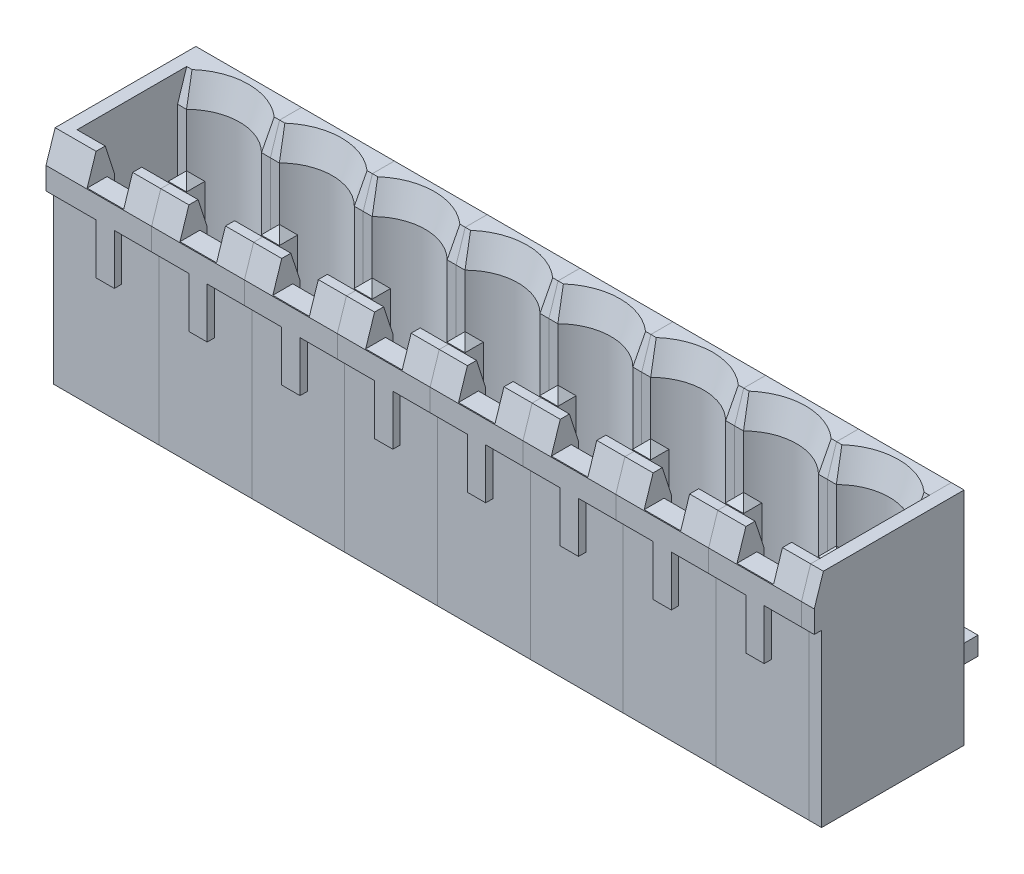
from build123d import *
from OCP.BRepFilletAPI import BRepFilletAPI_MakeChamfer

# Parameters (mm, degrees)
SKETCH_1_W             = 5.08
SKETCH_1_H             = 12.1
EXTRUDE_1_DEPTH        = 8.2
CUT_EXTRUDE_1_DEPTH    = 8.7
SKETCH_3_R             = 1.2
EXTRUDE_2_DEPTH        = 2
FILLET_1_R             = 0.25
CHAMFER_1_SIZE         = 0.5
CHAMFER_1_SIZE2        = 1.538841769
SKETCH_4_W             = 2
SKETCH_4_H             = 1.010953213
CUT_EXTRUDE_2_DEPTH    = 4.75
SKETCH_5_W             = 2
SKETCH_5_H             = 1.705458635
CUT_EXTRUDE_3_DEPTH    = 1.5
CHAMFER_2_SIZE         = 0.5
CHAMFER_2_SIZE2        = 1.538841769
SKETCH_6_W             = 5.08
SKETCH_6_H             = 6.6
CUT_EXTRUDE_4_DEPTH    = 0.4
SKETCH_7_W             = 2.04
SKETCH_7_H             = 2.75
CUT_EXTRUDE_5_DEPTH    = 0.4
EXTRUDE_1_2_DEPTH      = 0.5
EXTRUDE_1_2_DEPTH_BACK = 0.5
CHAMFER_3_SIZE         = 0.5
SKETCH_9_W             = 1
SKETCH_9_H             = 2.1
SKETCH_9_W_2           = 1.04
CUT_EXTRUDE_6_DEPTH    = 6
PATTERN_LINEAR_1_COUNT = 8
PATTERN_LINEAR_1_PITCH = 5.08
EXTRUDE_3_DEPTH        = 0.7
EXTRUDE_4_DEPTH        = 0.7
MOVE_BODY_1_ANGLE      = 180


with BuildPart() as part:
    # Эскиз1 → Extrude 1 (new body)
    with BuildSketch(Plane(origin=(0, 0, 0), x_dir=(1, 0, 0), z_dir=(0, 1, 0))):
        Rectangle(SKETCH_1_W, SKETCH_1_H)
    extrude(amount=EXTRUDE_1_DEPTH)

    # Эскиз2 → Вырез-Вытянуть1 (cut)
    with BuildSketch(Plane.XY.offset(6.05)):
        with BuildLine():
            Line((-2.54, 6.7), (2.54, 6.7))
            Line((2.54, 6.7), (2.54, 1.7))
            Line((2.54, 1.7), (2.05121915, 1.7))
            ThreePointArc((2.05121915, 1.7), (0, 0.85), (-2.05121915, 1.7))
            Line((-2.05121915, 1.7), (-2.54, 1.7))
            Line((-2.54, 1.7), (-2.54, 6.7))
        make_face()
    extrude(amount=-CUT_EXTRUDE_1_DEPTH, mode=Mode.SUBTRACT)

    # Эскиз3 → Бобышка-Вытянуть2 (add)
    with BuildSketch(Plane.XY.offset(-2.65)):
        with Locations((0, 3.75)):
            Circle(SKETCH_3_R)
    extrude(amount=EXTRUDE_2_DEPTH)

    # Скругление1
    fillet_1_edges = [part.edges().sort_by_distance(p)[0] for p in [
        (-1.2, 3.75, -0.65),
    ]]
    fillet(fillet_1_edges, radius=FILLET_1_R)

    # Фаска1: one chamfer whose edges measure the first distance from different faces: ONE call of the kernel's chamfer builder (chamfer() names one face for all edges)
    chamfer_1_edges_1 = [part.edges().sort_by_distance(p)[0] for p in [
        (0, 6.7, 6.05),
    ]]
    chamfer_1_side_1 = [part.faces().sort_by_distance(p)[0] for p in [
        (0, 7.45, 6.05),
    ]]
    chamfer_1_edges_2 = [part.edges().sort_by_distance(p)[0] for p in [
        (2.295609575, 1.7, 6.05),
        (-2.295609575, 1.7, 6.05),
        (0, 0.85, 6.05),
    ]]
    chamfer_1_side_2 = [part.faces().sort_by_distance(p)[0] for p in [
        (0, 0.655214235, 6.05),
    ]]
    chamfer_1 = BRepFilletAPI_MakeChamfer(part.part.solid().wrapped)
    for e in chamfer_1_edges_1:
        chamfer_1.Add(CHAMFER_1_SIZE, CHAMFER_1_SIZE2, e.wrapped, chamfer_1_side_1[0].wrapped)  # the first distance lies on this face
    for e in chamfer_1_edges_2:
        chamfer_1.Add(CHAMFER_1_SIZE, CHAMFER_1_SIZE2, e.wrapped, chamfer_1_side_2[0].wrapped)  # the first distance lies on this face
    add(Compound.cast(chamfer_1.Shape()), mode=Mode.REPLACE)

    # Эскиз4 → Вырез-Вытянуть2 (cut)
    with BuildSketch(Plane.XY.offset(6.05)):
        with Locations((0, 6.594523394)):
            Rectangle(SKETCH_4_W, SKETCH_4_H)
    extrude(amount=-CUT_EXTRUDE_2_DEPTH, mode=Mode.SUBTRACT)

    # Эскиз5 → Вырез-Вытянуть3 (cut)
    with BuildSketch(Plane.XY.offset(6.05)):
        with Locations((0, 7.552729318)):
            Rectangle(SKETCH_5_W, SKETCH_5_H)
    extrude(amount=-CUT_EXTRUDE_3_DEPTH, mode=Mode.SUBTRACT)

    # Фаска2
    chamfer_2_edges = [part.edges().sort_by_distance(p)[0] for p in [
        (-1.77, 8.2, 6.05),
    ]]
    chamfer_2_side = [part.faces().sort_by_distance(p)[0] for p in [
        (-1.77, 7.7, 6.05),
    ]]
    chamfer(chamfer_2_edges, length=CHAMFER_2_SIZE, length2=CHAMFER_2_SIZE2, reference=chamfer_2_side[0])

    # Эскиз6 → Вырез-Вытянуть4 (cut)
    with BuildSketch(Plane(origin=(0, 8.2, 0), x_dir=(1, 0, 0), z_dir=(0, 1, 0))):
        with Locations((0, 2.75)):
            Rectangle(SKETCH_6_W, SKETCH_6_H)
    extrude(amount=-CUT_EXTRUDE_4_DEPTH, mode=Mode.SUBTRACT)

    # Эскиз7 → Вырез-Вытянуть5 (cut)
    with BuildSketch(Plane(origin=(0, 8.2, 0), x_dir=(1, 0, 0), z_dir=(0, 1, 0))):
        with Locations((1.52, -1.925)):
            Rectangle(SKETCH_7_W, SKETCH_7_H)
        with Locations((-1.52, -1.925)):
            Rectangle(SKETCH_7_W, SKETCH_7_H)
    extrude(amount=-CUT_EXTRUDE_5_DEPTH, mode=Mode.SUBTRACT)

    # Эскиз9 → Вырез-Вытянуть6 (cut)
    with BuildSketch(Plane.XZ):
        with Locations((0, -5)):
            Rectangle(SKETCH_9_W, SKETCH_9_H)
        with Locations((-2.02, -5)):
            Rectangle(SKETCH_9_W_2, SKETCH_9_H)
        with Locations((2.02, -5)):
            Rectangle(SKETCH_9_W_2, SKETCH_9_H)
    extrude(amount=-CUT_EXTRUDE_6_DEPTH, mode=Mode.SUBTRACT)


with BuildPart() as body_2:
    # Эскиз8 → Extrude 1 2 (new, two sides: drawn at the far end of the back side and taken through both)
    with BuildSketch(Plane(origin=(0, 0, 0), x_dir=(0, 0, -1), z_dir=(1, 0, 0)).offset(-EXTRUDE_1_2_DEPTH_BACK)):
        with BuildLine():
            Line((-3.65, 3.25), (3.95, 3.25))
            Line((3.95, 3.25), (3.95, -4))
            Line((3.95, -4), (4.95, -4))
            Line((4.95, -4), (4.95, 3.25))
            ThreePointArc((4.95, 3.25), (4.657106781, 3.957106781), (3.95, 4.25))
            Line((3.95, 4.25), (-3.65, 4.25))
            Line((-3.65, 4.25), (-3.65, 3.25))
        make_face()
    extrude(amount=EXTRUDE_1_2_DEPTH + EXTRUDE_1_2_DEPTH_BACK)

    # Фаска3
    chamfer_3_edges = [body_2.edges().sort_by_distance(p)[0] for p in [
        (0, 3.25, 3.65),
        (0, 4.25, 3.65),
        (0, -4, -4.95),
        (0, -4, -3.95),
        (0.5, -4, -4.45),
        (0.5, 3.75, 3.65),
        (-0.5, 3.75, 3.65),
        (-0.5, -4, -4.45),
    ]]
    chamfer(chamfer_3_edges, length=CHAMFER_3_SIZE - 0.0001)  # a hair under: the kernel refuses the full size


with BuildPart() as pattern_linear_1_1:
    # Линейный массив1: pattern copy
    add(body_2.part.moved(Location(Vector(-1, 0, 0) * (1 * PATTERN_LINEAR_1_PITCH))))


with BuildPart() as pattern_linear_1_2:
    # Линейный массив1: pattern copy
    add(body_2.part.moved(Location(Vector(-1, 0, 0) * (2 * PATTERN_LINEAR_1_PITCH))))


with BuildPart() as pattern_linear_1_3:
    # Линейный массив1: pattern copy
    add(body_2.part.moved(Location(Vector(-1, 0, 0) * (3 * PATTERN_LINEAR_1_PITCH))))


with BuildPart() as pattern_linear_1_4:
    # Линейный массив1: pattern copy
    add(body_2.part.moved(Location(Vector(-1, 0, 0) * (4 * PATTERN_LINEAR_1_PITCH))))


with BuildPart() as pattern_linear_1_5:
    # Линейный массив1: pattern copy
    add(body_2.part.moved(Location(Vector(-1, 0, 0) * (5 * PATTERN_LINEAR_1_PITCH))))


with BuildPart() as pattern_linear_1_6:
    # Линейный массив1: pattern copy
    add(body_2.part.moved(Location(Vector(-1, 0, 0) * (6 * PATTERN_LINEAR_1_PITCH))))


with BuildPart() as pattern_linear_1_7:
    # Линейный массив1: pattern copy
    add(body_2.part.moved(Location(Vector(-1, 0, 0) * (7 * PATTERN_LINEAR_1_PITCH))))


with BuildPart() as pattern_linear_1_8:
    # Линейный массив1: pattern copy
    add(part.part.moved(Location(Vector(-1, 0, 0) * (1 * PATTERN_LINEAR_1_PITCH))))


with BuildPart() as pattern_linear_1_9:
    # Линейный массив1: pattern copy
    add(part.part.moved(Location(Vector(-1, 0, 0) * (2 * PATTERN_LINEAR_1_PITCH))))


with BuildPart() as pattern_linear_1_10:
    # Линейный массив1: pattern copy
    add(part.part.moved(Location(Vector(-1, 0, 0) * (3 * PATTERN_LINEAR_1_PITCH))))


with BuildPart() as pattern_linear_1_11:
    # Линейный массив1: pattern copy
    add(part.part.moved(Location(Vector(-1, 0, 0) * (4 * PATTERN_LINEAR_1_PITCH))))


with BuildPart() as pattern_linear_1_12:
    # Линейный массив1: pattern copy
    add(part.part.moved(Location(Vector(-1, 0, 0) * (5 * PATTERN_LINEAR_1_PITCH))))


with BuildPart() as pattern_linear_1_13:
    # Линейный массив1: pattern copy
    add(part.part.moved(Location(Vector(-1, 0, 0) * (6 * PATTERN_LINEAR_1_PITCH))))


with BuildPart() as pattern_linear_1_14:
    # Линейный массив1: pattern copy
    add(part.part.moved(Location(Vector(-1, 0, 0) * (7 * PATTERN_LINEAR_1_PITCH))))


with BuildPart() as part_1:
    add(part.part)

    # Эскиз10 → Бобышка-Вытянуть3 (add)
    with BuildSketch(Plane(origin=(2.54, 0, 0), x_dir=(0, 0, -1), z_dir=(1, 0, 0))):
        Polygon((6.05, 7.8), (-3.3, 7.8), (-3.3, 8.2), (-4.511158231, 8.2), (-6.05, 7.7), (-6.05, 0), (6.05, 0), align=None)
    extrude(amount=EXTRUDE_3_DEPTH)


with BuildPart() as body_17:
    # Эскиз11 → Бобышка-Вытянуть4 (new body)
    with BuildSketch(Plane.ZY.offset(38.1)):
        Polygon((-6.05, 7.8), (-6.05, 0), (6.05, 0), (6.05, 7.7), (4.511158231, 8.2), (3.3, 8.2), (3.3, 7.8), align=None)
    extrude(amount=EXTRUDE_4_DEPTH)


with BuildPart() as body_2_1:
    # Move Body 1: moved
    add(body_2.part.rotate(Axis((0, 0, 0), (0, 0.7071067811865488, 0.7071067811865462)), MOVE_BODY_1_ANGLE))


with BuildPart() as pattern_linear_1_1_1:
    # Move Body 1: moved
    add(pattern_linear_1_1.part.rotate(Axis((0, 0, 0), (0, 0.7071067811865488, 0.7071067811865462)), MOVE_BODY_1_ANGLE))


with BuildPart() as pattern_linear_1_8_1:
    # Move Body 1: moved
    add(pattern_linear_1_8.part.rotate(Axis((0, 0, 0), (0, 0.7071067811865488, 0.7071067811865462)), MOVE_BODY_1_ANGLE))


with BuildPart() as pattern_linear_1_9_1:
    # Move Body 1: moved
    add(pattern_linear_1_9.part.rotate(Axis((0, 0, 0), (0, 0.7071067811865488, 0.7071067811865462)), MOVE_BODY_1_ANGLE))


with BuildPart() as pattern_linear_1_10_1:
    # Move Body 1: moved
    add(pattern_linear_1_10.part.rotate(Axis((0, 0, 0), (0, 0.7071067811865488, 0.7071067811865462)), MOVE_BODY_1_ANGLE))


with BuildPart() as pattern_linear_1_2_1:
    # Move Body 1: moved
    add(pattern_linear_1_2.part.rotate(Axis((0, 0, 0), (0, 0.7071067811865488, 0.7071067811865462)), MOVE_BODY_1_ANGLE))


with BuildPart() as pattern_linear_1_3_1:
    # Move Body 1: moved
    add(pattern_linear_1_3.part.rotate(Axis((0, 0, 0), (0, 0.7071067811865488, 0.7071067811865462)), MOVE_BODY_1_ANGLE))


with BuildPart() as pattern_linear_1_4_1:
    # Move Body 1: moved
    add(pattern_linear_1_4.part.rotate(Axis((0, 0, 0), (0, 0.7071067811865488, 0.7071067811865462)), MOVE_BODY_1_ANGLE))


with BuildPart() as pattern_linear_1_5_1:
    # Move Body 1: moved
    add(pattern_linear_1_5.part.rotate(Axis((0, 0, 0), (0, 0.7071067811865488, 0.7071067811865462)), MOVE_BODY_1_ANGLE))


with BuildPart() as pattern_linear_1_6_1:
    # Move Body 1: moved
    add(pattern_linear_1_6.part.rotate(Axis((0, 0, 0), (0, 0.7071067811865488, 0.7071067811865462)), MOVE_BODY_1_ANGLE))


with BuildPart() as pattern_linear_1_7_1:
    # Move Body 1: moved
    add(pattern_linear_1_7.part.rotate(Axis((0, 0, 0), (0, 0.7071067811865488, 0.7071067811865462)), MOVE_BODY_1_ANGLE))


with BuildPart() as pattern_linear_1_11_1:
    # Move Body 1: moved
    add(pattern_linear_1_11.part.rotate(Axis((0, 0, 0), (0, 0.7071067811865488, 0.7071067811865462)), MOVE_BODY_1_ANGLE))


with BuildPart() as pattern_linear_1_12_1:
    # Move Body 1: moved
    add(pattern_linear_1_12.part.rotate(Axis((0, 0, 0), (0, 0.7071067811865488, 0.7071067811865462)), MOVE_BODY_1_ANGLE))


with BuildPart() as pattern_linear_1_13_1:
    # Move Body 1: moved
    add(pattern_linear_1_13.part.rotate(Axis((0, 0, 0), (0, 0.7071067811865488, 0.7071067811865462)), MOVE_BODY_1_ANGLE))


with BuildPart() as pattern_linear_1_14_1:
    # Move Body 1: moved
    add(pattern_linear_1_14.part.rotate(Axis((0, 0, 0), (0, 0.7071067811865488, 0.7071067811865462)), MOVE_BODY_1_ANGLE))


with BuildPart() as part_2:
    # Move Body 1: moved
    add(part_1.part.rotate(Axis((0, 0, 0), (0, 0.7071067811865488, 0.7071067811865462)), MOVE_BODY_1_ANGLE))


with BuildPart() as body_17_1:
    # Move Body 1: moved
    add(body_17.part.rotate(Axis((0, 0, 0), (0, 0.7071067811865488, 0.7071067811865462)), MOVE_BODY_1_ANGLE))


with BuildPart() as body_17_2:
    # Move Body 2: read off the stored shape, not the designer's step
    # Move Body 2: moved
    add(body_17_1.part.moved(Location((0, 4.45, 0))))


with BuildPart() as part_3:
    # Move Body 2 2: moved
    add(part_2.part.moved(Location((0, 4.45, 0))))


with BuildPart() as pattern_linear_1_14_2:
    # Move Body 2 3: moved
    add(pattern_linear_1_14_1.part.moved(Location((0, 4.45, 0))))


with BuildPart() as pattern_linear_1_13_2:
    # Move Body 2 4: moved
    add(pattern_linear_1_13_1.part.moved(Location((0, 4.45, 0))))


with BuildPart() as pattern_linear_1_12_2:
    # Move Body 2 5: moved
    add(pattern_linear_1_12_1.part.moved(Location((0, 4.45, 0))))


with BuildPart() as pattern_linear_1_11_2:
    # Move Body 2 6: moved
    add(pattern_linear_1_11_1.part.moved(Location((0, 4.45, 0))))


with BuildPart() as pattern_linear_1_7_2:
    # Move Body 2 7: moved
    add(pattern_linear_1_7_1.part.moved(Location((0, 4.45, 0))))


with BuildPart() as pattern_linear_1_6_2:
    # Move Body 2 8: moved
    add(pattern_linear_1_6_1.part.moved(Location((0, 4.45, 0))))


with BuildPart() as pattern_linear_1_5_2:
    # Move Body 2 9: moved
    add(pattern_linear_1_5_1.part.moved(Location((0, 4.45, 0))))


with BuildPart() as pattern_linear_1_4_2:
    # Move Body 2 10: moved
    add(pattern_linear_1_4_1.part.moved(Location((0, 4.45, 0))))


with BuildPart() as pattern_linear_1_3_2:
    # Move Body 2 11: moved
    add(pattern_linear_1_3_1.part.moved(Location((0, 4.45, 0))))


with BuildPart() as pattern_linear_1_2_2:
    # Move Body 2 12: moved
    add(pattern_linear_1_2_1.part.moved(Location((0, 4.45, 0))))


with BuildPart() as pattern_linear_1_10_2:
    # Move Body 2 13: moved
    add(pattern_linear_1_10_1.part.moved(Location((0, 4.45, 0))))


with BuildPart() as pattern_linear_1_9_2:
    # Move Body 2 14: moved
    add(pattern_linear_1_9_1.part.moved(Location((0, 4.45, 0))))


with BuildPart() as pattern_linear_1_8_2:
    # Move Body 2 15: moved
    add(pattern_linear_1_8_1.part.moved(Location((0, 4.45, 0))))


with BuildPart() as pattern_linear_1_1_2:
    # Move Body 2 16: moved
    add(pattern_linear_1_1_1.part.moved(Location((0, 4.45, 0))))


with BuildPart() as body_2_2:
    # Move Body 2 17: moved
    add(body_2_1.part.moved(Location((0, 4.45, 0))))


solid = Compound([body_17_2.part, part_3.part, pattern_linear_1_14_2.part, pattern_linear_1_13_2.part, pattern_linear_1_12_2.part, pattern_linear_1_11_2.part, pattern_linear_1_7_2.part, pattern_linear_1_6_2.part, pattern_linear_1_5_2.part, pattern_linear_1_4_2.part, pattern_linear_1_3_2.part, pattern_linear_1_2_2.part, pattern_linear_1_10_2.part, pattern_linear_1_9_2.part, pattern_linear_1_8_2.part, pattern_linear_1_1_2.part, body_2_2.part])
